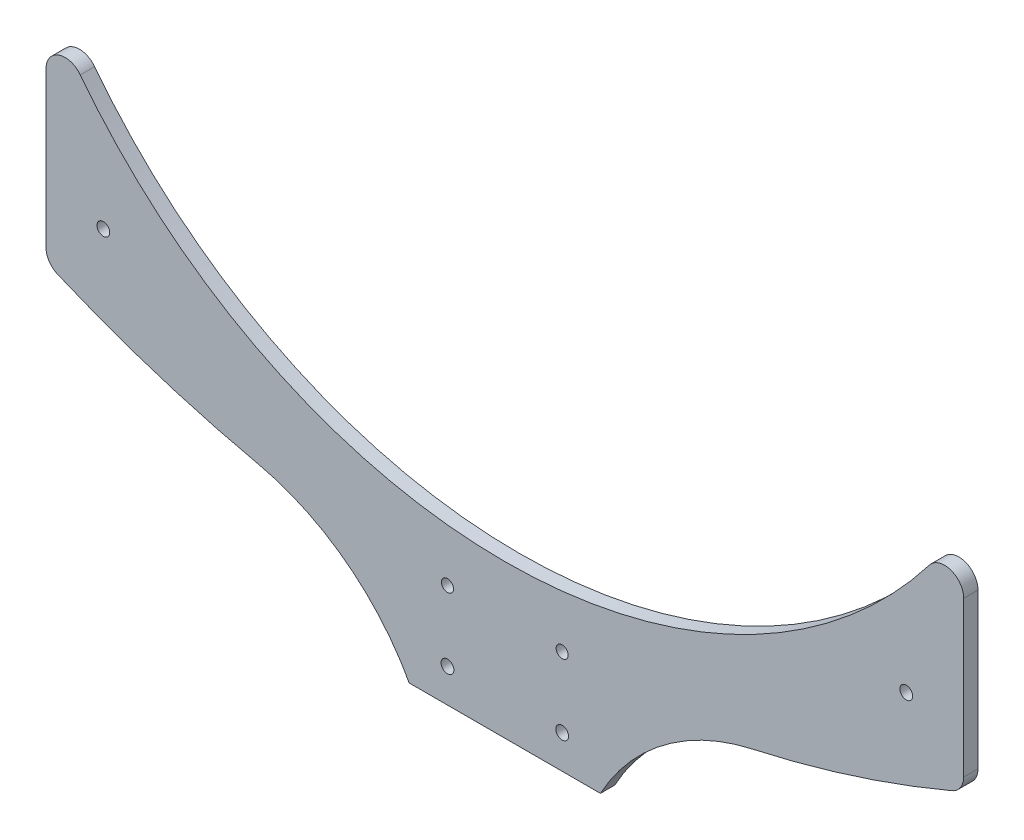
from build123d import *

# Parameters (mm, degrees)
SKETCH1_R           = 2.125
BOSS_EXTRUDE1_DEPTH = 4.7625
FILLET1_R           = 6.35
FILLET2_R           = 6.35
SKETCH3_W           = 63.5
SKETCH3_H           = 50.8
BOSS_EXTRUDE2_DEPTH = 4.7625
FILLET3_R           = 76.2
SKETCH8_R           = 2.125
CUT_EXTRUDE3_DEPTH  = 19.05
SKETCH10_R          = 2
CUT_EXTRUDE7_DEPTH  = 335.215390296


with BuildPart() as part:
    # Sketch1 → Boss-Extrude1 (new body)
    with BuildSketch(Plane.XY):
        with BuildLine():
            Line((0, 0), (0, -76.2))
            ThreePointArc((0, -76.2), (152.4, -108.007732044), (304.8, -76.2))
            Line((304.8, -76.2), (304.8, 0))
            ThreePointArc((304.8, 0), (152.4, -86.218997603), (0, 0))
        make_face()
        with Locations(Location((19.05, -57.207732044, 0), (0, 0, 180))):
            Circle(SKETCH1_R, mode=Mode.SUBTRACT)
        with Locations(Location((285.75, -57.207732044, 0), (0, 0, 180))):
            Circle(SKETCH1_R, mode=Mode.SUBTRACT)
    extrude(amount=BOSS_EXTRUDE1_DEPTH)

    # Fillet1
    fillet1_edges = [part.edges().sort_by_distance(p)[0] for p in [
        (304.8, 0, 2.38125),
        (0, 0, 2.38125),
    ]]
    fillet(fillet1_edges, radius=FILLET1_R)

    # Fillet2
    fillet2_edges = [part.edges().sort_by_distance(p)[0] for p in [
        (304.8, -76.2, 2.38125),
        (0, -76.2, 2.38125),
    ]]
    fillet(fillet2_edges, radius=FILLET2_R)

    # Sketch3 → Boss-Extrude2 (add)
    with BuildSketch(Plane.XY.offset(4.7625)):
        with Locations((152.4, -111.618997603)):
            Rectangle(SKETCH3_W, SKETCH3_H)
    extrude(amount=-BOSS_EXTRUDE2_DEPTH)

    # Fillet3
    # the kernel refuses this fillet: 76.2 mm, written as the material it adds along each edge
    with BuildSketch(Plane(origin=(184.15, -106.682510638, 4.7625), x_dir=(0.9886965633546299, 0.14993033585883936, 0), z_dir=(0, 0, -1))) as fillet3_piece_1:
        with BuildLine():
            CenterArc((56.174032607, 76.02868739), FILLET3_R, 217.166641645, 48.990660759)
            Line((-4.548359679, 29.993580407), (-5.762807525, 29.072878267))
            ThreePointArc((-5.762807525, 29.072878267), (-3.780953402, 14.768296372), (-1.506773563, -0.228493832))
            Line((-1.506773563, -0.228493832), (0.102134605, -1.520573748))
            ThreePointArc((0.102134605, -1.520573748), (25.533651185, -0.667436951), (50.965167766, -1.520573748))
            Line((50.965167766, -1.520573748), (51.06730237, 0))
        make_face()
    extrude(amount=4.7625)
    with BuildSketch(Plane(origin=(120.65, -106.682510638, 4.7625), x_dir=(0, -1, 0), z_dir=(0, 0, -1))) as fillet3_piece_2:
        with BuildLine():
            CenterArc((66.747110364, 66.938079624), FILLET3_R, 192.465587038, 48.990660759)
            Line((-7.656537796, 50.490066353), (-9.144610759, 50.161106088))
            ThreePointArc((-9.144610759, 50.161106088), (-4.488161518, 25.14496413), (-1.518699114, -0.127))
            Line((-1.518699114, -0.127), (0, -1.524))
            ThreePointArc((0, -1.524), (15.168243483, -1.524), (29.608274497, -1.338761592))
            Line((29.608274497, -1.338761592), (30.336486965, 0))
        make_face()
    extrude(amount=4.7625)

    # Sketch8 → Cut-Extrude3 (cut)
    with BuildSketch(Plane(origin=(0, 0, 0), x_dir=(-1, 0, 0), z_dir=(0, 0, -1))):
        with Locations((-171.45, -125.902330937)):
            Circle(SKETCH8_R)
        with Locations((-133.35, -125.902330937)):
            Circle(SKETCH8_R)
    extrude(amount=-CUT_EXTRUDE3_DEPTH, mode=Mode.SUBTRACT)

    # Sketch10 → Cut-Extrude7 (cut, through all)
    with BuildSketch(Plane.XY.offset(4.7625)):
        with Locations((133.35, -102.618997603)):
            Circle(SKETCH10_R)
        with Locations((171.45, -102.618997603)):
            Circle(SKETCH10_R)
    extrude(amount=-CUT_EXTRUDE7_DEPTH, mode=Mode.SUBTRACT)


solid = part.part
